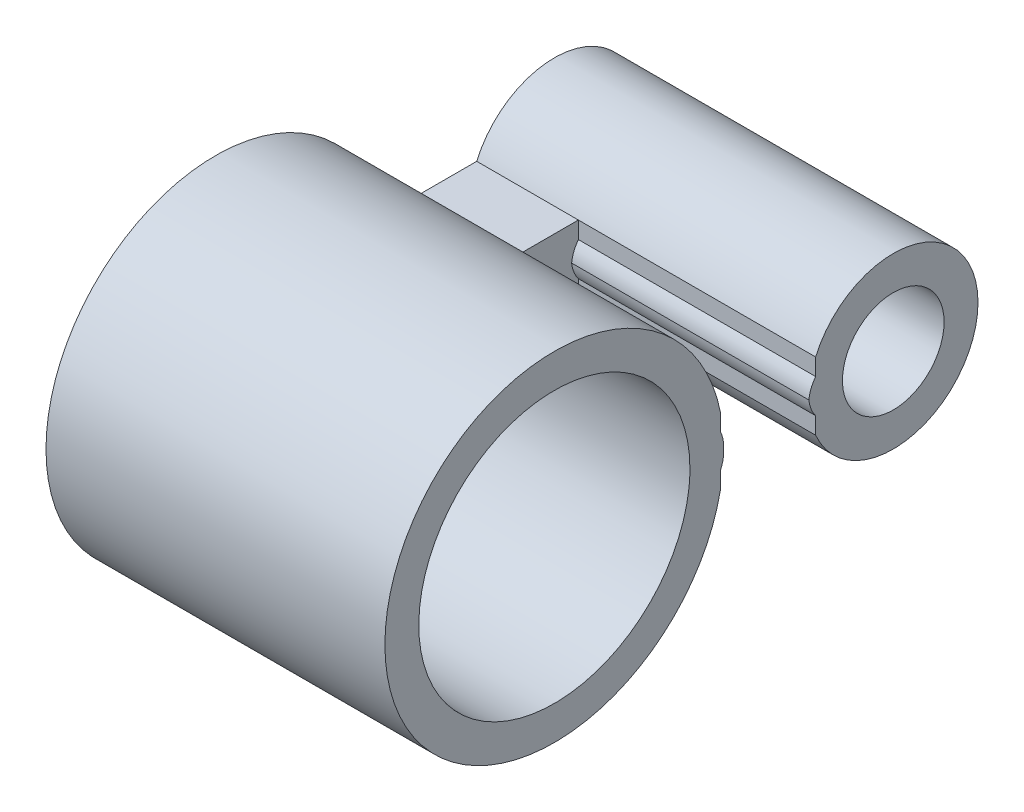
from build123d import *

# Parameters (mm, degrees)
BOSS_EXTRUDE3_DEPTH = 10
BOSS_EXTRUDE4_DEPTH = 1
CUT_EXTRUDE1_START  = -9
SKETCH3_R           = 4
SKETCH3_R_2         = 1.5
CUT_EXTRUDE1_DEPTH  = 9
SKETCH4_W           = 2.809732667
SKETCH4_H           = 2
CUT_EXTRUDE2_DEPTH  = 8
SKETCH5_W           = 2.809732667
SKETCH5_H           = 2
BOSS_EXTRUDE5_DEPTH = 1
BOSS_EXTRUDE6_START = -8
BOSS_EXTRUDE6_DEPTH = 8
FILLET3_R           = 1


with BuildPart() as part:
    # Sketch1 → Boss-Extrude3 (new body)
    with BuildSketch(Plane(origin=(0, 0, 0), x_dir=(0, 0, -1), z_dir=(1, 0, 0))):
        with BuildLine():
            Line((7.708712153, -1), (4.898979486, -1))
            ThreePointArc((4.898979486, -1), (-5, 0), (4.898979486, 1))
            Line((4.898979486, 1), (7.708712153, 1))
            ThreePointArc((7.708712153, 1), (12.5, 0), (7.708712153, -1))
        make_face()
        with BuildLine():
            ThreePointArc((8.881966011, -1), (11.5, 0), (8.881966011, 1))
            Line((8.881966011, 1), (8.881966011, 0.5))
            Line((8.881966011, 0.5), (3.872983346, 0.5))
            Line((3.872983346, 0.5), (3.872983346, 1))
            ThreePointArc((3.872983346, 1), (-4, 0), (3.872983346, -1))
            Line((3.872983346, -1), (3.872983346, -0.5))
            Line((3.872983346, -0.5), (8.881966011, -0.5))
            Line((8.881966011, -0.5), (8.881966011, -1))
        make_face(mode=Mode.SUBTRACT)
    extrude(amount=BOSS_EXTRUDE3_DEPTH)

    # Sketch2 → Boss-Extrude4 (add)
    with BuildSketch(Plane.ZY):
        with BuildLine():
            Line((-8.585786438, 0.5), (-3.968626967, 0.5))
            ThreePointArc((-3.968626967, 0.5), (4, 0), (-3.968626967, -0.5))
            Line((-3.968626967, -0.5), (-8.585786438, -0.5))
            ThreePointArc((-8.585786438, -0.5), (-11.5, 0), (-8.585786438, 0.5))
        make_face()
    extrude(amount=-BOSS_EXTRUDE4_DEPTH)

    # Sketch3 → Cut-Extrude1 (cut)
    with BuildSketch(Plane(origin=(10, 0, 0), x_dir=(0, 0, -1), z_dir=(1, 0, 0)).offset(CUT_EXTRUDE1_START)):
        Circle(SKETCH3_R)
        with Locations((10, 0)):
            Circle(SKETCH3_R_2)
    extrude(amount=CUT_EXTRUDE1_DEPTH, mode=Mode.SUBTRACT)

    # Sketch4 → Cut-Extrude2 (cut)
    with BuildSketch(Plane(origin=(10, 0, 0), x_dir=(0, 0, -1), z_dir=(1, 0, 0))):
        with Locations((6.30384582, 0)):
            Rectangle(SKETCH4_W, SKETCH4_H)
    extrude(amount=-CUT_EXTRUDE2_DEPTH, mode=Mode.SUBTRACT)

    # Sketch5 → Boss-Extrude5 (add)
    with BuildSketch(Plane(origin=(2, 0, 0), x_dir=(0, 0, -1), z_dir=(1, 0, 0))):
        with Locations((6.30384582, 0)):
            Rectangle(SKETCH5_W, SKETCH5_H)
    extrude(amount=BOSS_EXTRUDE5_DEPTH)

    # Sketch6 → Boss-Extrude6 (add)
    with BuildSketch(Plane(origin=(10, 0, 0), x_dir=(0, 0, -1), z_dir=(1, 0, 0)).offset(BOSS_EXTRUDE6_START)):
        with BuildLine():
            Line((3.968626967, 0.5), (4.969531559, 0.5))
            ThreePointArc((4.969531559, 0.5), (4.994621499, 0), (4.969531559, -0.5))
            Line((4.969531559, -0.5), (3.968626967, -0.5))
            ThreePointArc((3.968626967, -0.5), (4, 0), (3.968626967, 0.5))
        make_face()
        with BuildLine():
            Line((8.585786438, 0.5), (7.550510257, 0.5))
            ThreePointArc((7.550510257, 0.5), (7.5, 0), (7.550510257, -0.5))
            Line((7.550510257, -0.5), (8.585786438, -0.5))
            ThreePointArc((8.585786438, -0.5), (8.5, 0), (8.585786438, 0.5))
        make_face()
    extrude(amount=BOSS_EXTRUDE6_DEPTH)

    # Fillet3
    # the kernel refuses this fillet: 1 mm, written as the material it takes off along each edge
    with BuildSketch(Plane(origin=(3, 0.5, -4.969531559), x_dir=(0, -0.9982310173351231, -0.059454487047532374), z_dir=(1, 0, 0))) as fillet3_piece_1:
        with BuildLine():
            CenterArc((0.366534345, -0.999168363), FILLET3_R, 87.663129738, 24.097452775)
            Line((-0.004194637, -0.070427268), (0, 0))
            ThreePointArc((0, 0), (0.203654559, 0.004153711), (0.407309118, 0))
        make_face()
    extrude(amount=8.018272795, mode=Mode.SUBTRACT)
    with BuildSketch(Plane(origin=(3, -0.5, -4.969531559), x_dir=(0, 0, 1), z_dir=(1, 0, 0))) as fillet3_piece_2:
        with BuildLine():
            CenterArc((0.97560874, -0.425290994), FILLET3_R, 154.830916209, 24.097452775)
            ThreePointArc((-0.024216355, -0.406588595), (-0.016254541, -0.203047341), (0, 0))
            Line((0, 0), (0.070552073, 0))
        make_face()
    extrude(amount=8.018272795, mode=Mode.SUBTRACT)
    with BuildSketch(Plane(origin=(3, -0.5, -7.550510257), x_dir=(0, 8.127970304186451e-12, -1.0), z_dir=(1, 0, 0))) as fillet3_piece_3:
        with BuildLine():
            CenterArc((0.953276133, 0.606512125), FILLET3_R, 175.928109784, 41.40962211)
            ThreePointArc((-0.044199608, 0.677520208), (-0.045207292, 0.337252633), (0, 0))
            Line((0, 0), (0.158201895, 0))
        make_face()
    extrude(amount=8.697401022, mode=Mode.SUBTRACT)
    with BuildSketch(Plane(origin=(3, 0.5, -7.550510257), x_dir=(0, -0.9978788138478943, 0.06509894679270496), z_dir=(1, 0, 0))) as fillet3_piece_4:
        with BuildLine():
            CenterArc((0.543168327, 0.990737357), FILLET3_R, 236.394802514, 41.40962211)
            Line((-0.010298777, 0.15786632), (0, 0))
            ThreePointArc((0, 0), (0.339480204, -0.023156608), (0.678960409, 0))
        make_face()
    extrude(amount=8.697401022, mode=Mode.SUBTRACT)


solid = part.part
